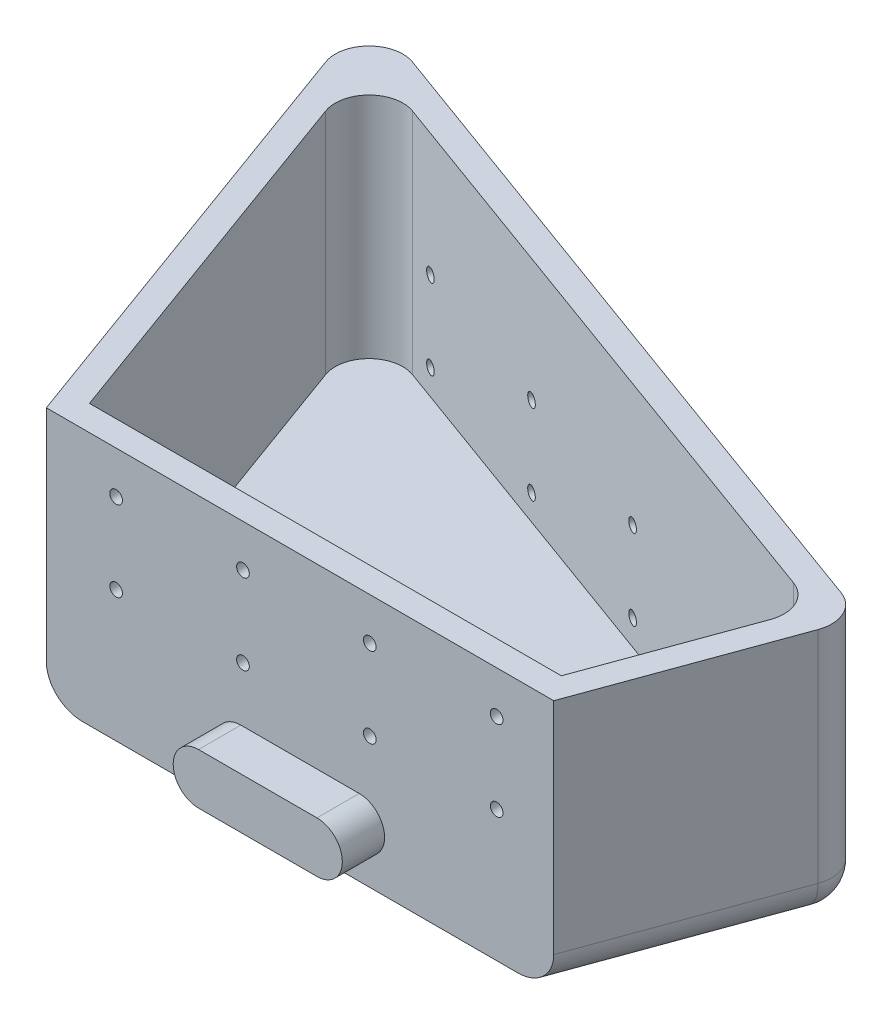
from build123d import *

# Parameters (mm, degrees)
BOSS_EXTRUDE1_DEPTH = 30
BOSS_EXTRUDE2_DEPTH = 3
FILLET1_R           = 4
SKETCH4_R           = 0.75
CUT_EXTRUDE1_DEPTH  = 3
SKETCH5_R           = 0.75
CUT_EXTRUDE2_DEPTH  = 3
SKETCH6_R           = 0.75
CUT_EXTRUDE3_DEPTH  = 3
BOSS_EXTRUDE3_DEPTH = 5


with BuildPart() as part:
    # Sketch1 → Boss-Extrude1 (new body)
    with BuildSketch(Plane(origin=(0, 0, 0), x_dir=(1, 0, 0), z_dir=(0, 1, 0))):
        Polygon((14.623899198, -23.65646826), (-7.214314858, 36.34353174), (84.334275017, 3.022570036), (74.623899198, -23.65646826), align=None)
        Polygon((16.724521813, -20.65646826), (-2.194843303, 31.324060184), (80.489136724, 1.229552604), (72.523276583, -20.65646826), align=None, mode=Mode.SUBTRACT)
    extrude(amount=BOSS_EXTRUDE1_DEPTH)

    # Sketch3 → Boss-Extrude2 (add)
    with BuildSketch(Plane(origin=(0, 0, 0), x_dir=(1, 0, 0), z_dir=(0, 1, 0))):
        Polygon((-2.194843303, 31.324060184), (16.724521813, -20.65646826), (72.523276583, -20.65646826), (80.489136724, 1.229552604), align=None)
    extrude(amount=BOSS_EXTRUDE2_DEPTH)

    # Fillet1
    fillet1_edges = [part.edges().sort_by_distance(p)[0] for p in [
        (84.334275017, 15, -3.022570036),
        (80.489136724, 16.5, -1.229552604),
        (-2.194843303, 16.5, -31.324060184),
        (-7.214314858, 15, -36.34353174),
        (3.70479217, 0, -6.34353174),
        (79.479087107, 0, 10.316949112),
        (38.559980079, 0, -19.683050888),
    ]]
    fillet(fillet1_edges, radius=FILLET1_R)

    # Sketch4 → Cut-Extrude1 (cut)
    with BuildSketch(Plane(origin=(10.836671422, 0, -29.773510035), x_dir=(-0.9396926207859058, 0, -0.34202014332567643), z_dir=(0.34202014332567643, 0, -0.9396926207859058))):
        with Locations((-59.368569311, 15.5)):
            Circle(SKETCH4_R)
        with Locations((-39.368569311, 15.5)):
            Circle(SKETCH4_R)
        with Locations((-19.368569311, 15.5)):
            Circle(SKETCH4_R)
        with Locations((0.631430689, 15.5)):
            Circle(SKETCH4_R)
        with Locations((0.631430689, 6)):
            Circle(SKETCH4_R)
        with Locations((-19.368569311, 6)):
            Circle(SKETCH4_R)
        with Locations((-39.368569311, 6)):
            Circle(SKETCH4_R)
        with Locations((-59.368569311, 6)):
            Circle(SKETCH4_R)
    extrude(amount=-CUT_EXTRUDE1_DEPTH, mode=Mode.SUBTRACT)

    # Sketch5 → Cut-Extrude2 (cut)
    with BuildSketch(Plane(origin=(5.310185614, 0, -1.932749502), x_dir=(0.34202014332566644, 0, 0.9396926207859093), z_dir=(-0.9396926207859092, 0, 0.3420201433256664))):
        with Locations((12.231476758, 15.5)):
            Circle(SKETCH5_R)
        with Locations((12.231476758, 6)):
            Circle(SKETCH5_R)
    extrude(amount=-CUT_EXTRUDE2_DEPTH, mode=Mode.SUBTRACT)

    # Sketch6 → Cut-Extrude3 (cut)
    with BuildSketch(Plane.XY.offset(23.65646826)):
        with Locations((22.873899198, 25)):
            Circle(SKETCH6_R)
        with Locations((37.873899198, 25)):
            Circle(SKETCH6_R)
        with Locations((52.873899198, 25)):
            Circle(SKETCH6_R)
        with Locations((67.873899198, 25)):
            Circle(SKETCH6_R)
        with Locations((22.873899198, 15.5)):
            Circle(SKETCH6_R)
        with Locations((37.873899198, 15.5)):
            Circle(SKETCH6_R)
        with Locations((52.873899198, 15.5)):
            Circle(SKETCH6_R)
        with Locations((67.873899198, 15.5)):
            Circle(SKETCH6_R)
    extrude(amount=-CUT_EXTRUDE3_DEPTH, mode=Mode.SUBTRACT)

    # Sketch7 → Boss-Extrude3 (add)
    with BuildSketch(Plane.XY.offset(23.65646826)):
        with BuildLine():
            Line((37.623899198, 9), (51.623899198, 9))
            ThreePointArc((51.623899198, 9), (54.623899198, 6), (51.623899198, 3))
            Line((51.623899198, 3), (37.623899198, 3))
            ThreePointArc((37.623899198, 3), (34.623899198, 6), (37.623899198, 9))
        make_face()
    extrude(amount=BOSS_EXTRUDE3_DEPTH)


solid = part.part
